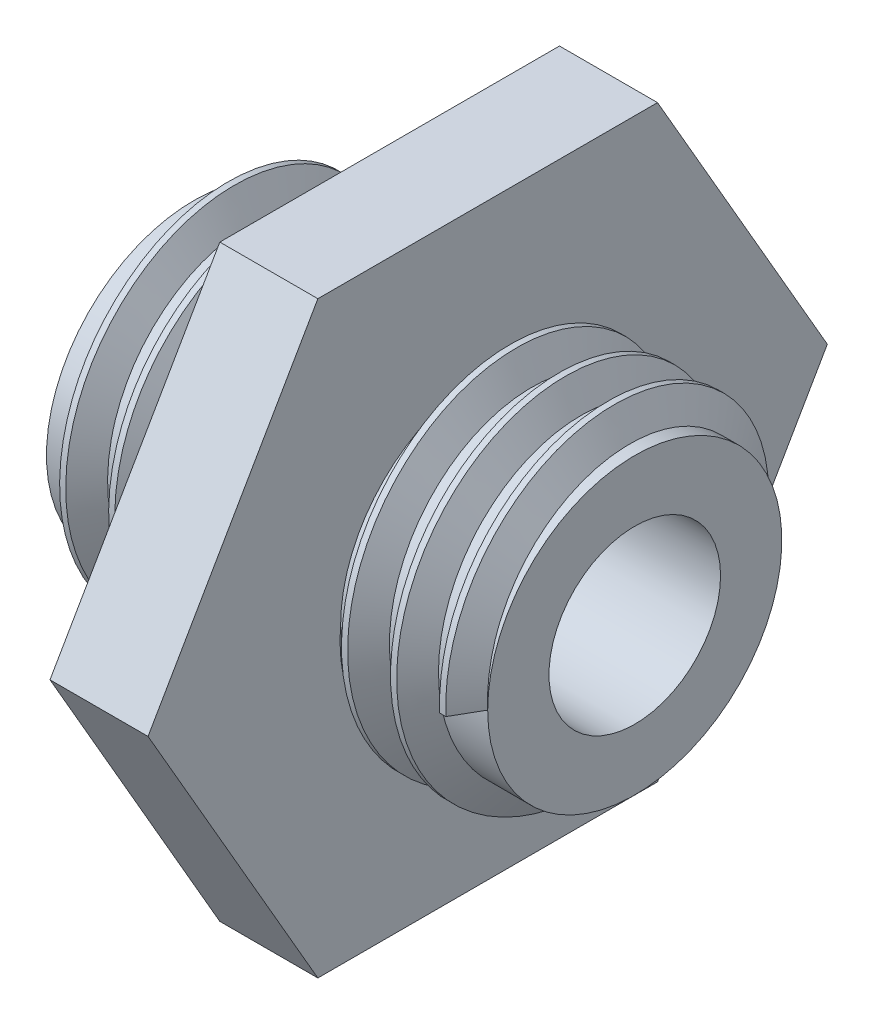
from build123d import *

# Parameters (mm, degrees)
SKETCH1_R                = 3
BOSS_EXTRUDE1_DEPTH      = 1
BOSS_EXTRUDE2_DEPTH      = 4
BOSS_EXTRUDE2_DEPTH_BACK = 5
SKETCH2_R                = 3
SKETCH2_R_2              = 1.75
THREAD1_PITCH            = 1
THREAD2_PITCH            = 1


with BuildPart() as part:
    # Sketch1 → Boss-Extrude1 (new, symmetric)
    with BuildSketch(Plane(origin=(0, 0, 0), x_dir=(0, 0, -1), z_dir=(1, 0, 0))):
        Polygon((6.92820323, 0), (3.464101615, 6), (-3.464101615, 6), (-6.92820323, 0), (-3.464101615, -6), (3.464101615, -6), align=None)
        Circle(SKETCH1_R, mode=Mode.SUBTRACT)
    extrude(amount=BOSS_EXTRUDE1_DEPTH, both=True)

    # Sketch2 → Boss-Extrude2 (add, two sides: drawn at the far end of the back side and taken through both)
    with BuildSketch(Plane(origin=(0, 0, 0), x_dir=(0, 0, -1), z_dir=(1, 0, 0)).offset(-BOSS_EXTRUDE2_DEPTH_BACK)):
        Circle(SKETCH2_R)
        Circle(SKETCH2_R_2, mode=Mode.SUBTRACT)
    extrude(amount=BOSS_EXTRUDE2_DEPTH + BOSS_EXTRUDE2_DEPTH_BACK)

    # Thread1: the profile of Thread Profile1 profile screwed along a right-hand helix of 3 turns, 8 arcs to a turn; built about Z, then put on its axis
    thread1_z = Axis((0, 0, 0), (0, 0, 1))
    thread1_corners = [(2.9997, 0, -0.000173205), (3.541265875, 0, 0.312499999), (3.541265875, 0, 0.437499999), (2.9997, 0, 0.750173202)]
    with BuildLine(mode=Mode.PRIVATE) as thread1_profile:
        Line(thread1_corners[0], thread1_corners[1])
        Line(thread1_corners[1], thread1_corners[2])
        Line(thread1_corners[2], thread1_corners[3])
        Line(thread1_corners[3], thread1_corners[0])
    thread1_cap = Face(thread1_profile.wire())
    thread1_turn_angles = [0, 22.5, 45, 67.5, 90, 112.5, 135, 157.5, 180, 202.5, 225, 247.5, 270, 292.5, 315, 337.5, 360]
    thread1_turn_weights = [1, 0.9238795325112867, 1, 0.9238795325112867, 1, 0.9238795325112867, 1, 0.9238795325112867, 1, 0.9238795325112867, 1, 0.9238795325112867, 1, 0.9238795325112867, 1, 0.9238795325112867, 1]
    thread1_turn_rails = [Edge.make_bspline([Vector(p[0], p[1], 0).rotate(thread1_z, thread1_turn_angles[k]) / thread1_turn_weights[k] + Vector(0, 0, p[2] + THREAD1_PITCH * thread1_turn_angles[k] / 360) for k in range(17)], [0, 0, 0, 1, 1, 2, 2, 3, 3, 4, 4, 5, 5, 6, 6, 7, 7, 8, 8, 8], 2, thread1_turn_weights) for p in thread1_corners]
    thread1_turn_sides = [Face.make_surface_from_curves(thread1_turn_rails[p[0]], thread1_turn_rails[p[1]]) for p in [(0, 1), (1, 2), (2, 3), (3, 0)]]
    thread1 = Plane(origin=(4, 0, 0), x_dir=(0, 0, 1), z_dir=(-1, 0, 0)) * Solid(Shell([*[p.moved(Location((0, 0, THREAD1_PITCH * i))) for i in range(3) for p in thread1_turn_sides], thread1_cap, thread1_cap.rotate(thread1_z, 1080).moved(Location((0, 0, THREAD1_PITCH * 1080 / 360)))]))
    add(thread1)

    # Thread2: the profile of Thread Profile2 profile screwed along a right-hand helix of 4 turns, 8 arcs to a turn; built about Z, then put on its axis
    thread2_z = Axis((0, 0, 0), (0, 0, 1))
    thread2_corners = [(2.9997, 0, -0.000173205), (3.541265875, 0, 0.312499999), (3.541265875, 0, 0.437499999), (2.9997, 0, 0.750173202)]
    with BuildLine(mode=Mode.PRIVATE) as thread2_profile:
        Line(thread2_corners[0], thread2_corners[1])
        Line(thread2_corners[1], thread2_corners[2])
        Line(thread2_corners[2], thread2_corners[3])
        Line(thread2_corners[3], thread2_corners[0])
    thread2_cap = Face(thread2_profile.wire())
    thread2_turn_angles = [0, 22.5, 45, 67.5, 90, 112.5, 135, 157.5, 180, 202.5, 225, 247.5, 270, 292.5, 315, 337.5, 360]
    thread2_turn_weights = [1, 0.9238795325112867, 1, 0.9238795325112867, 1, 0.9238795325112867, 1, 0.9238795325112867, 1, 0.9238795325112867, 1, 0.9238795325112867, 1, 0.9238795325112867, 1, 0.9238795325112867, 1]
    thread2_turn_rails = [Edge.make_bspline([Vector(p[0], p[1], 0).rotate(thread2_z, thread2_turn_angles[k]) / thread2_turn_weights[k] + Vector(0, 0, p[2] + THREAD2_PITCH * thread2_turn_angles[k] / 360) for k in range(17)], [0, 0, 0, 1, 1, 2, 2, 3, 3, 4, 4, 5, 5, 6, 6, 7, 7, 8, 8, 8], 2, thread2_turn_weights) for p in thread2_corners]
    thread2_turn_sides = [Face.make_surface_from_curves(thread2_turn_rails[p[0]], thread2_turn_rails[p[1]]) for p in [(0, 1), (1, 2), (2, 3), (3, 0)]]
    thread2 = Plane(origin=(-5, 0, 0), x_dir=(0, 0, -1), z_dir=(1, 0, 0)) * Solid(Shell([*[p.moved(Location((0, 0, THREAD2_PITCH * i))) for i in range(4) for p in thread2_turn_sides], thread2_cap, thread2_cap.rotate(thread2_z, 1440).moved(Location((0, 0, THREAD2_PITCH * 1440 / 360)))]))
    add(thread2)


solid = part.part
